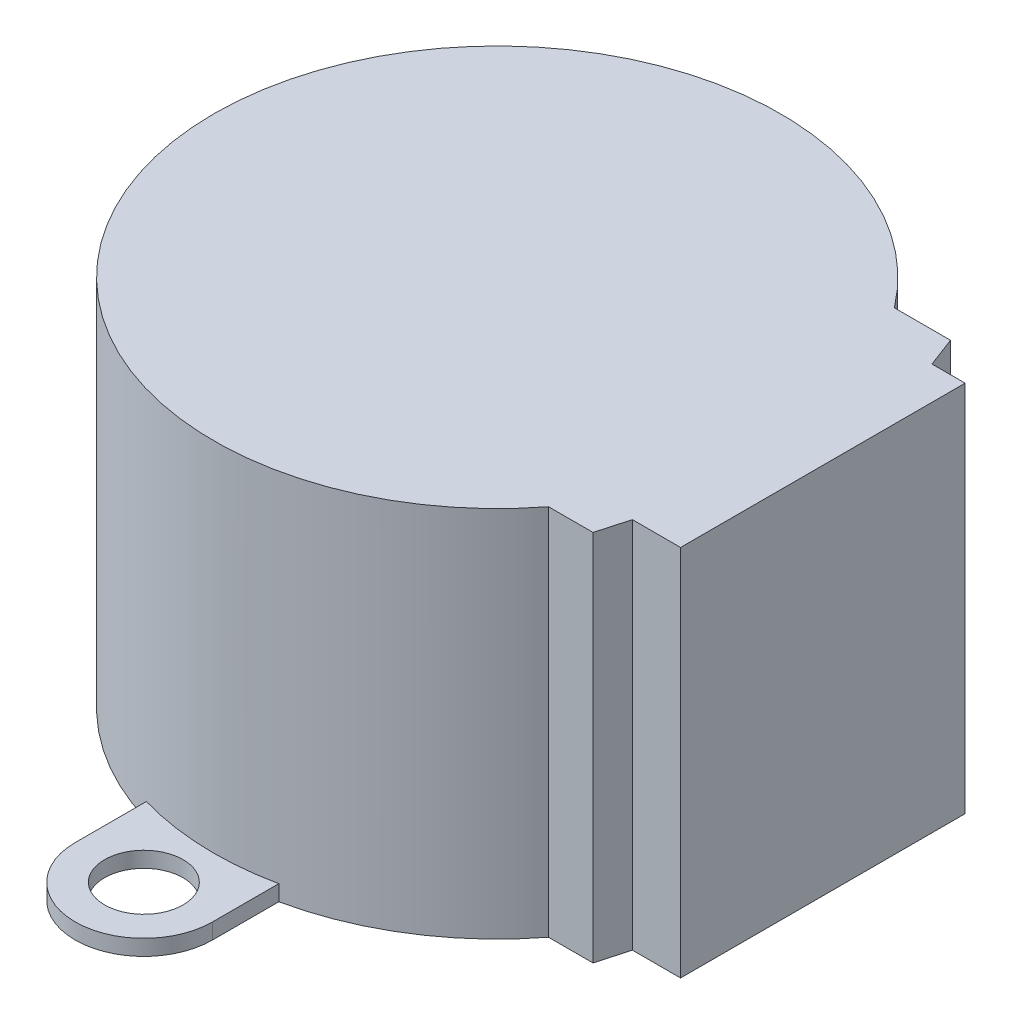
from build123d import *

# Parameters (mm, degrees)
SKETCH1_R           = 4.6
SKETCH1_R_2         = 2.5
BOSS_EXTRUDE1_DEPTH = 19
SKETCH1_3_R         = 4.6
SKETCH1_3_R_2       = 2.5
SKETCH1_3_R_3       = 2
BOSS_EXTRUDE2_DEPTH = 1.6
SKETCH1_4_R         = 2
BOSS_EXTRUDE3_DEPTH = 0.8
SKETCH1_5_R         = 2.5
BOSS_EXTRUDE4_DEPTH = 4
BOSS_EXTRUDE5_DEPTH = 6
FILLET1_R           = 1
FILLET2_R           = 1


with BuildPart() as part:
    # Sketch1 → Boss-Extrude1 (new body)
    # profile 1 of 3: a face of its own
    with BuildSketch(Plane(origin=(0, 0, 0), x_dir=(1, 0, 0), z_dir=(0, 1, 0))):
        with BuildLine():
            ThreePointArc((11.466935703, 8.771283954), (-14.436938211, 0.029184365), (11.431379714, -8.817573048))
            Line((11.431379714, -8.817573048), (13.700622891, -8.817573048))
            Line((13.700622891, -8.817573048), (14.138880413, -7.25))
            Line((14.138880413, -7.25), (16.593765248, -7.25))
            Line((16.593765248, -7.25), (16.593765248, 7.25))
            Line((16.593765248, 7.25), (14.905644331, 7.25))
            Line((14.905644331, 7.25), (14.326809253, 8.771283954))
            Line((14.326809253, 8.771283954), (11.466935703, 8.771283954))
        make_face()
        with Locations((-8.506234752, 0)):
            Circle(SKETCH1_R, mode=Mode.SUBTRACT)
    # profile 2 of 3: a face of its own
    with BuildSketch(Plane(origin=(0, 0, 0), x_dir=(1, 0, 0), z_dir=(0, 1, 0))):
        with Locations((-8.506234752, 0)):
            Circle(SKETCH1_R)
        with Locations((-8.506234752, 0)):
            Circle(SKETCH1_R_2, mode=Mode.SUBTRACT)
    # profile 3 of 3: a face of its own
    with BuildSketch(Plane(origin=(0, 0, 0), x_dir=(1, 0, 0), z_dir=(0, 1, 0))):
        with Locations((-8.506234752, 0)):
            Circle(SKETCH1_R_2)
    extrude(amount=BOSS_EXTRUDE1_DEPTH)

    # Sketch1<3> → Boss-Extrude2 (add)
    # profile 1 of 2: a face of its own
    with BuildSketch(Plane(origin=(0, 0, 0), x_dir=(1, 0, 0), z_dir=(0, 1, 0))):
        with Locations(Location((-8.506234752, 0, 0), (0, 0, 270))):
            Circle(SKETCH1_3_R)
        with Locations(Location((-8.506234752, 0, 0), (0, 0, 270))):
            Circle(SKETCH1_3_R_2, mode=Mode.SUBTRACT)
    # profile 2 of 2: a face of its own
    with BuildSketch(Plane(origin=(0, 0, 0), x_dir=(1, 0, 0), z_dir=(0, 1, 0))):
        with Locations((-0.506234752, 17.5)):
            Circle(SKETCH1_3_R_3)
    extrude(amount=-BOSS_EXTRUDE2_DEPTH)


with BuildPart() as boss_extrude2_kept_piece:
    # of the separate pieces the step leaves, the one the design keeps (boss_extrude2_pieces_kept)
    add(part.part.solids().sort_by_distance((11.466935703, 0, -8.771283954))[0])

    # Sketch1<4> → Boss-Extrude3 (add)
    # profile 1 of 2: a face of its own
    with BuildSketch(Plane(origin=(0, 0, 0), x_dir=(1, 0, 0), z_dir=(0, 1, 0))):
        with BuildLine():
            ThreePointArc((-4.006234752, 13.869971872), (-0.52182238, 14.427534025), (2.993765248, 14.123151428))
            Line((2.993765248, 14.123151428), (2.993765248, 17.5))
            ThreePointArc((2.993765248, 17.5), (-0.506234752, 21), (-4.006234752, 17.5))
            Line((-4.006234752, 17.5), (-4.006234752, 13.869971872))
        make_face()
        with Locations(Location((-0.506234752, 17.5, 0), (0, 0, 270))):
            Circle(SKETCH1_4_R, mode=Mode.SUBTRACT)
    # profile 2 of 2: a face of its own
    with BuildSketch(Plane(origin=(0, 0, 0), x_dir=(1, 0, 0), z_dir=(0, 1, 0))):
        with BuildLine():
            ThreePointArc((2.993765248, -14.123151428), (-0.52182238, -14.427534025), (-4.006234752, -13.869971872))
            Line((-4.006234752, -13.869971872), (-4.006234752, -17.5))
            ThreePointArc((-4.006234752, -17.5), (-0.506234752, -21), (2.993765248, -17.5))
            Line((2.993765248, -17.5), (2.993765248, -14.123151428))
        make_face()
        with Locations(Location((-0.506234752, -17.5, 0), (0, 0, 270))):
            Circle(SKETCH1_4_R, mode=Mode.SUBTRACT)
    extrude(amount=BOSS_EXTRUDE3_DEPTH)

    # Sketch1<5> → Boss-Extrude4 (add)
    with BuildSketch(Plane(origin=(0, 0, 0), x_dir=(1, 0, 0), z_dir=(0, 1, 0))):
        with Locations(Location((-8.506234752, 0, 0), (0, 0, 270))):
            Circle(SKETCH1_5_R)
    extrude(amount=-BOSS_EXTRUDE4_DEPTH)

    # Sketch5 → Boss-Extrude5 (add)
    with BuildSketch(Plane.XZ.offset(4)):
        with BuildLine():
            Line((-9.968251002, 1.5), (-10.506234752, 1.5))
            ThreePointArc((-10.506234752, 1.5), (-11.006234752, 0), (-10.506234752, -1.5))
            Line((-10.506234752, -1.5), (-9.968251002, -1.5))
            Line((-9.968251002, -1.5), (-9.968251002, 1.5))
        make_face()
        with BuildLine():
            Line((-6.506234752, 1.5), (-9.968251002, 1.5))
            Line((-9.968251002, 1.5), (-9.968251002, -1.5))
            Line((-9.968251002, -1.5), (-6.506234752, -1.5))
            ThreePointArc((-6.506234752, -1.5), (-6.134526507, -0.790569415), (-6.006234752, 0))
            ThreePointArc((-6.006234752, 0), (-6.134526507, 0.790569415), (-6.506234752, 1.5))
        make_face()
    extrude(amount=BOSS_EXTRUDE5_DEPTH)

    # Fillet1
    # the kernel refuses this fillet: 1 mm, written as the material it adds along each edge
    with BuildSketch(Plane(origin=(-4.006234752, -4, 1.5), x_dir=(0, 0, 1), z_dir=(-1, 0, 0))) as fillet1_piece_1_section:
        with BuildLine():
            CenterArc((FILLET1_R, -FILLET1_R), FILLET1_R, 90, 90)
            Line((0, -FILLET1_R), (0, 0))
            Line((0, 0), (FILLET1_R, 0))
        make_face()
    fillet1_piece_1 = extrude(amount=9, mode=Mode.PRIVATE)
    fillet1_piece_1 = fillet1_piece_1 & Plane(origin=(-8.506234752, -4.243408623, 0), x_dir=(0, 0, 1), z_dir=(0, 1, 0)) * Cylinder(2.5, 22, mode=Mode.PRIVATE)
    add(fillet1_piece_1)

    # Fillet2
    # the kernel refuses this fillet: 1 mm, written as the material it adds along each edge
    with BuildSketch(Plane(origin=(-13.006234752, -4, -1.5), x_dir=(0, 0, -1), z_dir=(1, 0, 0))) as fillet2_piece_1_section:
        with BuildLine():
            CenterArc((FILLET2_R, -FILLET2_R), FILLET2_R, 90, 90)
            Line((0, -FILLET2_R), (0, 0))
            Line((0, 0), (FILLET2_R, 0))
        make_face()
    fillet2_piece_1 = extrude(amount=9, mode=Mode.PRIVATE)
    fillet2_piece_1 = fillet2_piece_1 & Plane(origin=(-8.506234752, -4.243408623, 0), x_dir=(0, 0, 1), z_dir=(0, 1, 0)) * Cylinder(2.5, 22, mode=Mode.PRIVATE)
    add(fillet2_piece_1)


solid = boss_extrude2_kept_piece.part
